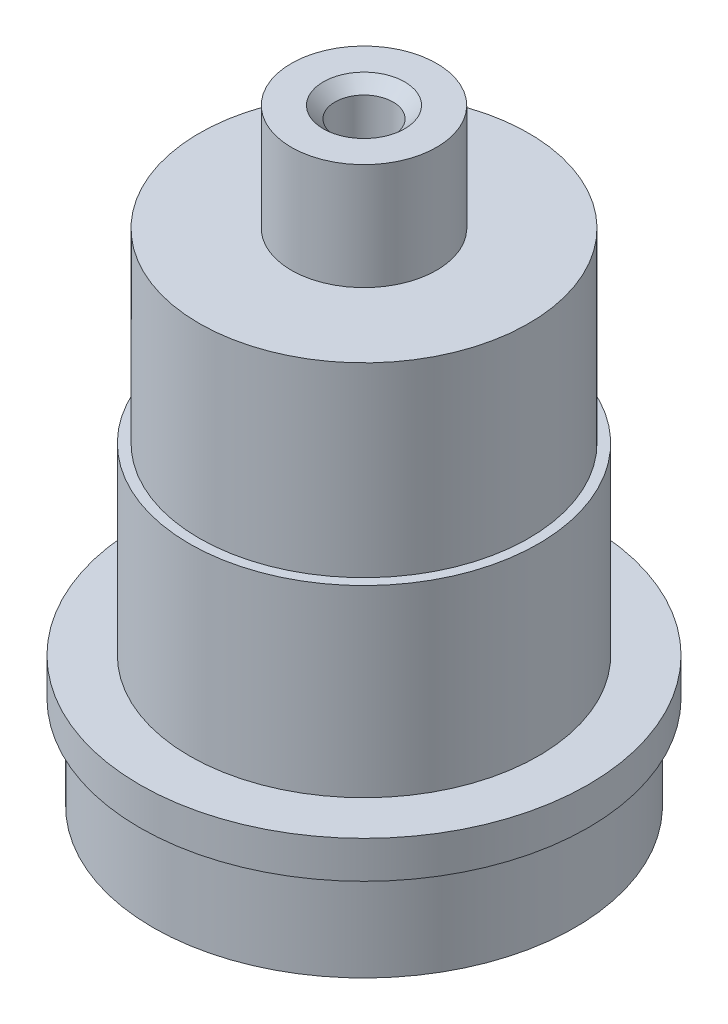
from build123d import *

# Parameters (mm, degrees)
SKETCH1_R           = 23.0505
BOSS_EXTRUDE1_DEPTH = 10.16
SKETCH2_R           = 24.4856
BOSS_EXTRUDE2_DEPTH = 4.064
SKETCH3_R           = 19.05
BOSS_EXTRUDE3_DEPTH = 20.066
SKETCH4_R           = 17.9959
BOSS_EXTRUDE4_DEPTH = 20.32
SKETCH5_R           = 7.9375
BOSS_EXTRUDE5_DEPTH = 11.6332
SKETCH7_R           = 3.175
CUT_EXTRUDE1_DEPTH  = 17.018
CHAMFER1_SIZE       = 1.27


with BuildPart() as part:
    # Sketch1 → Boss-Extrude1 (new body)
    with BuildSketch(Plane(origin=(0, 0, 0), x_dir=(1, 0, 0), z_dir=(0, 1, 0))):
        Circle(SKETCH1_R)
    extrude(amount=BOSS_EXTRUDE1_DEPTH)

    # Sketch2 → Boss-Extrude2 (add)
    with BuildSketch(Plane(origin=(0, 10.16, 0), x_dir=(1, 0, 0), z_dir=(0, 1, 0))):
        Circle(SKETCH2_R)
    extrude(amount=BOSS_EXTRUDE2_DEPTH)

    # Sketch3 → Boss-Extrude3 (add)
    with BuildSketch(Plane(origin=(0, 14.224, 0), x_dir=(1, 0, 0), z_dir=(0, 1, 0))):
        Circle(SKETCH3_R)
    extrude(amount=BOSS_EXTRUDE3_DEPTH)

    # Sketch4 → Boss-Extrude4 (add)
    with BuildSketch(Plane(origin=(0, 34.29, 0), x_dir=(1, 0, 0), z_dir=(0, 1, 0))):
        Circle(SKETCH4_R)
    extrude(amount=BOSS_EXTRUDE4_DEPTH)

    # Sketch5 → Boss-Extrude5 (add)
    with BuildSketch(Plane(origin=(0, 54.61, 0), x_dir=(1, 0, 0), z_dir=(0, 1, 0))):
        Circle(SKETCH5_R)
    extrude(amount=BOSS_EXTRUDE5_DEPTH)

    # Sketch7 → Cut-Extrude1 (cut)
    with BuildSketch(Plane(origin=(0, 66.2432, 0), x_dir=(1, 0, 0), z_dir=(0, 1, 0))):
        Circle(SKETCH7_R)
    extrude(amount=-CUT_EXTRUDE1_DEPTH, mode=Mode.SUBTRACT)

    # Chamfer1
    chamfer1_edges = [part.edges().sort_by_distance(p)[0] for p in [
        (-3.175, 66.2432, 0),
    ]]
    chamfer(chamfer1_edges, length=CHAMFER1_SIZE)


solid = part.part
